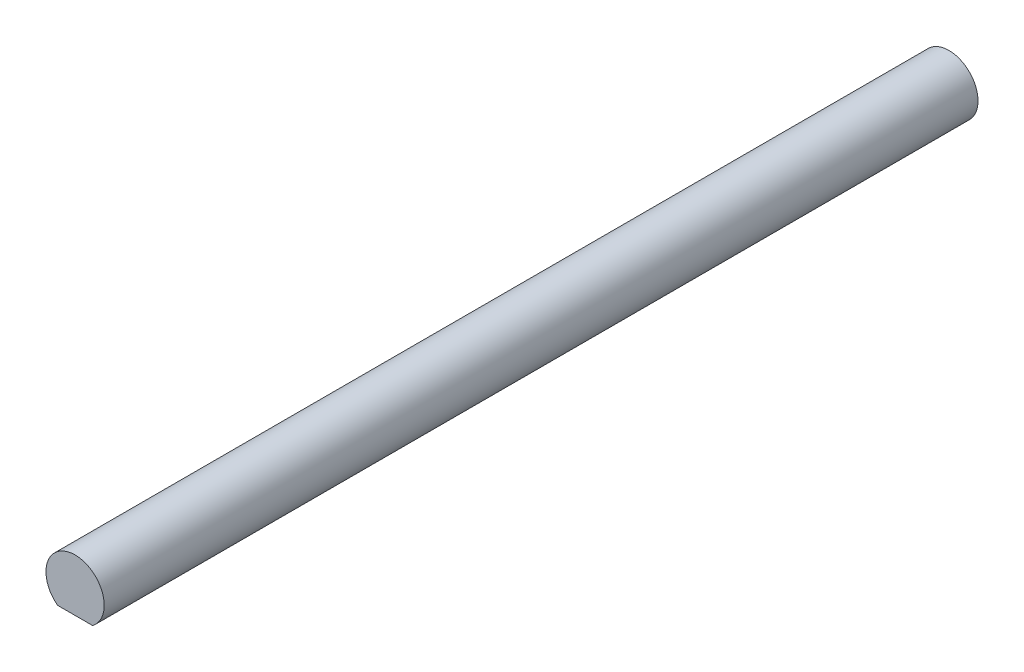
from build123d import *

# Parameters (mm, degrees)
BOSS_EXTRUDE1_DEPTH      = 47.625
BOSS_EXTRUDE1_DEPTH_BACK = 47.625


with BuildPart() as part:
    # Sketch1 → Boss-Extrude1 (new, two sides: drawn at the far end of the back side and taken through both)
    with BuildSketch(Plane.XY.offset(-BOSS_EXTRUDE1_DEPTH_BACK)):
        with BuildLine():
            Line((-1.905, -2.54), (1.905, -2.54))
            ThreePointArc((1.905, -2.54), (0, 3.175), (-1.905, -2.54))
        make_face()
    extrude(amount=BOSS_EXTRUDE1_DEPTH + BOSS_EXTRUDE1_DEPTH_BACK)


solid = part.part
